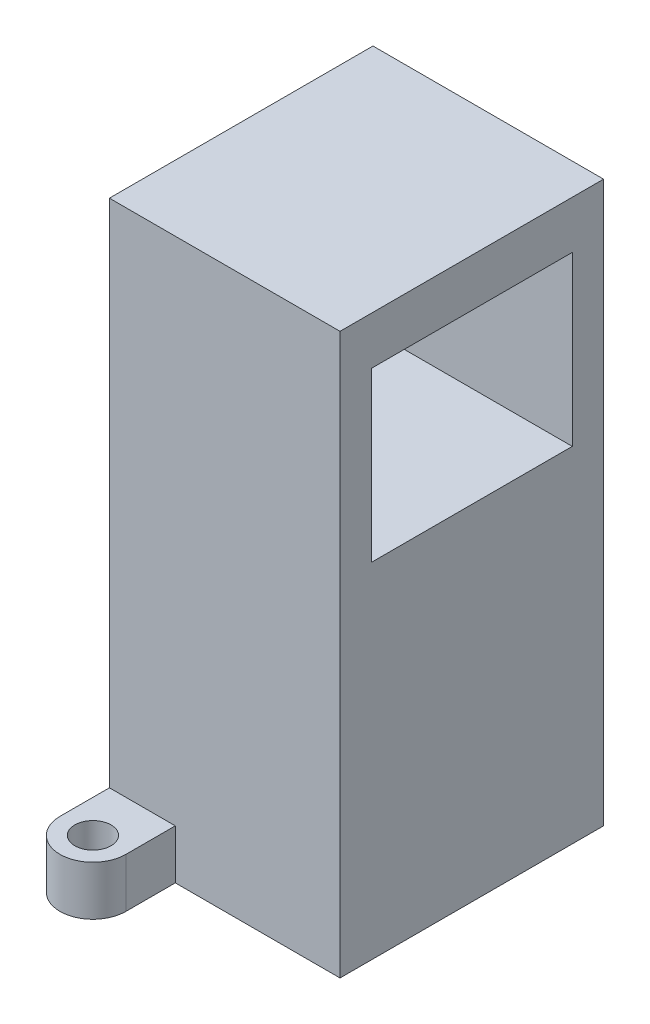
from build123d import *

# Parameters (mm, degrees)
SKETCH_1_W               = 14
SKETCH_1_H               = 16
EXTRUDE_1_DEPTH          = 34
CUT_EXTRUDE_1_DEPTH      = 36.623026261
CUT_EXTRUDE_1_DEPTH_BACK = 36.623026261
SKETCH_2_W               = 12.2
SKETCH_2_H               = 10.2
SKETCH_3_R               = 1.1
EXTRUDE_2_DEPTH          = 3


with BuildPart() as part:
    # 草图1 → 凸台-拉伸1 (new body)
    with BuildSketch(Plane(origin=(0, 0, 0), x_dir=(1, 0, 0), z_dir=(0, 1, 0))):
        Rectangle(SKETCH_1_W, SKETCH_1_H)
    extrude(amount=EXTRUDE_1_DEPTH)

    # 草图2 → 切除-拉伸1 (cut, two sides: drawn at the far end of the back side and taken through both)
    with BuildSketch(Plane(origin=(0, 0, 0), x_dir=(0, 0, -1), z_dir=(1, 0, 0)).offset(-CUT_EXTRUDE_1_DEPTH_BACK)):
        with Locations((0, 26)):
            Rectangle(SKETCH_2_W, SKETCH_2_H)
    extrude(amount=CUT_EXTRUDE_1_DEPTH + CUT_EXTRUDE_1_DEPTH_BACK, mode=Mode.SUBTRACT)

    # 草图3 → 凸台-拉伸2 (add)
    with BuildSketch(Plane(origin=(0, 0, 0), x_dir=(1, 0, 0), z_dir=(0, 1, 0))):
        with BuildLine():
            Line((-7, 8), (-7, 11))
            ThreePointArc((-7, 11), (-5, 13), (-3, 11))
            Line((-3, 11), (-3, 8))
            Line((-3, 8), (-7, 8))
        make_face()
        with Locations((-5, 11)):
            Circle(SKETCH_3_R, mode=Mode.SUBTRACT)
    extrude_2 = extrude(amount=EXTRUDE_2_DEPTH)

    # 镜向1: 凸台-拉伸2 across plane
    add(extrude_2.mirror(Plane.XY))


solid = part.part
